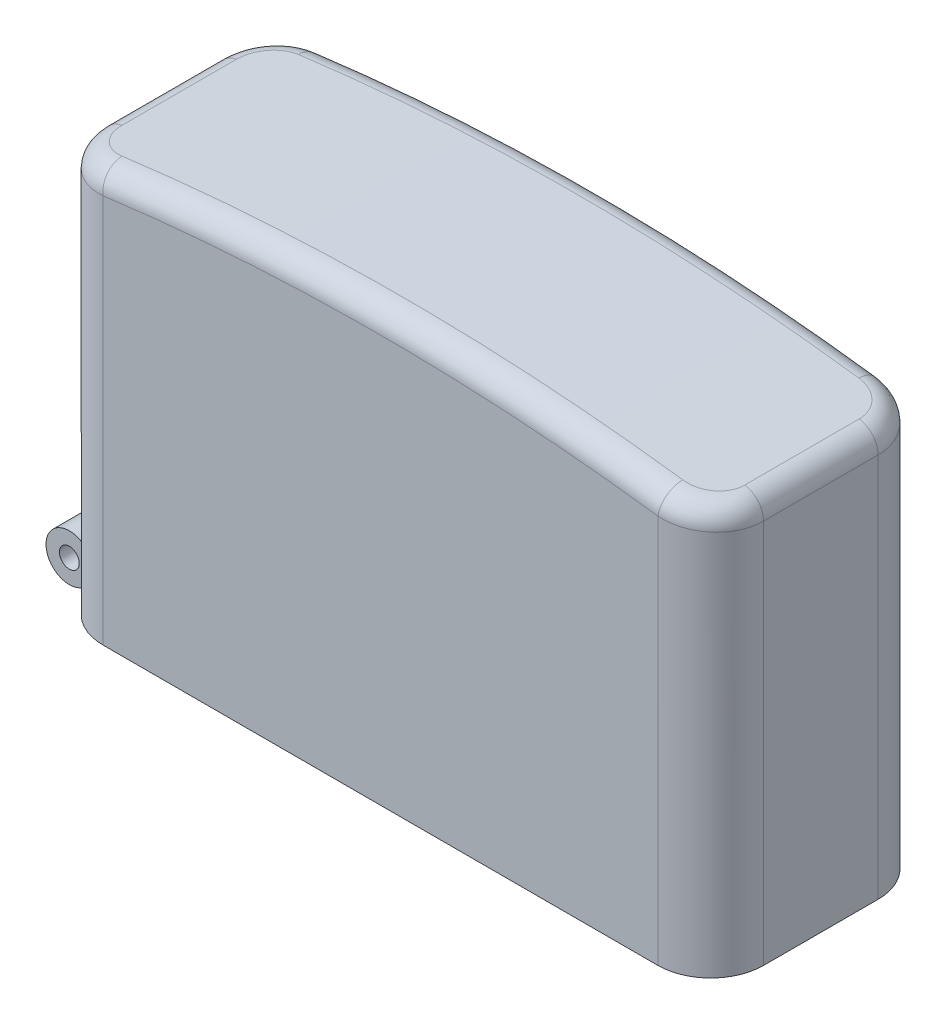
from build123d import *

# Parameters (mm, degrees)
BOSS_EXTRUDE1_DEPTH = 12.7
FILLET7_R           = 3.048
FILLET8_R           = 1.27
SHELL2_T            = -0.4572
SKETCH2_W           = 7.9502
SKETCH2_H           = 1.016
CUT_EXTRUDE1_DEPTH  = 11.7856
SKETCH4_W           = 1.3462
SKETCH4_H           = 1.5875
SKETCH5_R           = 0.5715
CUT_EXTRUDE2_DEPTH  = 47.593255212


with BuildPart() as part:
    # Sketch1 → Boss-Extrude1 (new body)
    with BuildSketch(Plane.XY):
        with BuildLine():
            Line((0, 0), (38.1, 0))
            Line((38.1, 0), (38.1, 23.2918))
            ThreePointArc((38.1, 23.2918), (19.05, 24.758348548), (0, 23.2918))
            Line((0, 23.2918), (0, 0))
        make_face()
    extrude(amount=BOSS_EXTRUDE1_DEPTH)

    # Fillet7
    fillet7_edges = [part.edges().sort_by_distance(p)[0] for p in [
        (38.1, 11.6459, 0),
        (38.1, 11.6459, 12.7),
        (0, 11.6459, 0),
        (0, 11.6459, 12.7),
    ]]
    fillet(fillet7_edges, radius=FILLET7_R)

    # Fillet8
    fillet8_edges = [part.edges().sort_by_distance(p)[0] for p in [
        (0, 23.2918, 6.35),
        (0.897565394, 23.427470684, 0.887922461),
        (19.05, 24.758348548, 0),
        (37.20243455, 23.427470691, 0.887922401),
        (38.1, 23.2918, 6.35),
        (37.20243455, 23.427470691, 11.812077599),
        (19.05, 24.758348548, 12.7),
        (0.897565394, 23.427470684, 11.812077539),
    ]]
    fillet(fillet8_edges, radius=FILLET8_R)

    # Shell2
    shell2_openings = [part.faces().sort_by_distance(p)[0] for p in [
        (19.05, 0, 6.35),
    ]]
    offset(amount=SHELL2_T, openings=shell2_openings, kind=Kind.INTERSECTION)

    # Sketch2 → Cut-Extrude1 (cut)
    with BuildSketch(Plane.ZY):
        with Locations((6.35, 0.508)):
            Rectangle(SKETCH2_W, SKETCH2_H)
    extrude(amount=-CUT_EXTRUDE1_DEPTH, mode=Mode.SUBTRACT)

    # Sketch4 → Revolve1 (revolve)
    with BuildSketch(Plane.XZ.offset(-1.016)):
        with Locations((-0.597849635, 6.35635)):
            Rectangle(SKETCH4_W, SKETCH4_H)
        with Locations((-0.597849635, 9.53135)):
            Rectangle(SKETCH4_W, SKETCH4_H)
        with Locations((-0.597849635, 3.18135)):
            Rectangle(SKETCH4_W, SKETCH4_H)
    revolve(axis=Axis((-1.270949635, 1.016, 10.3251), (0, 0, -1)))

    # Sketch5 → Cut-Extrude2 (cut, through all)
    with BuildSketch(Plane(origin=(0, 0, 2.3876), x_dir=(-1, 0, 0), z_dir=(0, 0, -1))):
        with Locations((1.270949635, 1.016)):
            Circle(SKETCH5_R)
    extrude(amount=-CUT_EXTRUDE2_DEPTH, mode=Mode.SUBTRACT)


solid = part.part
